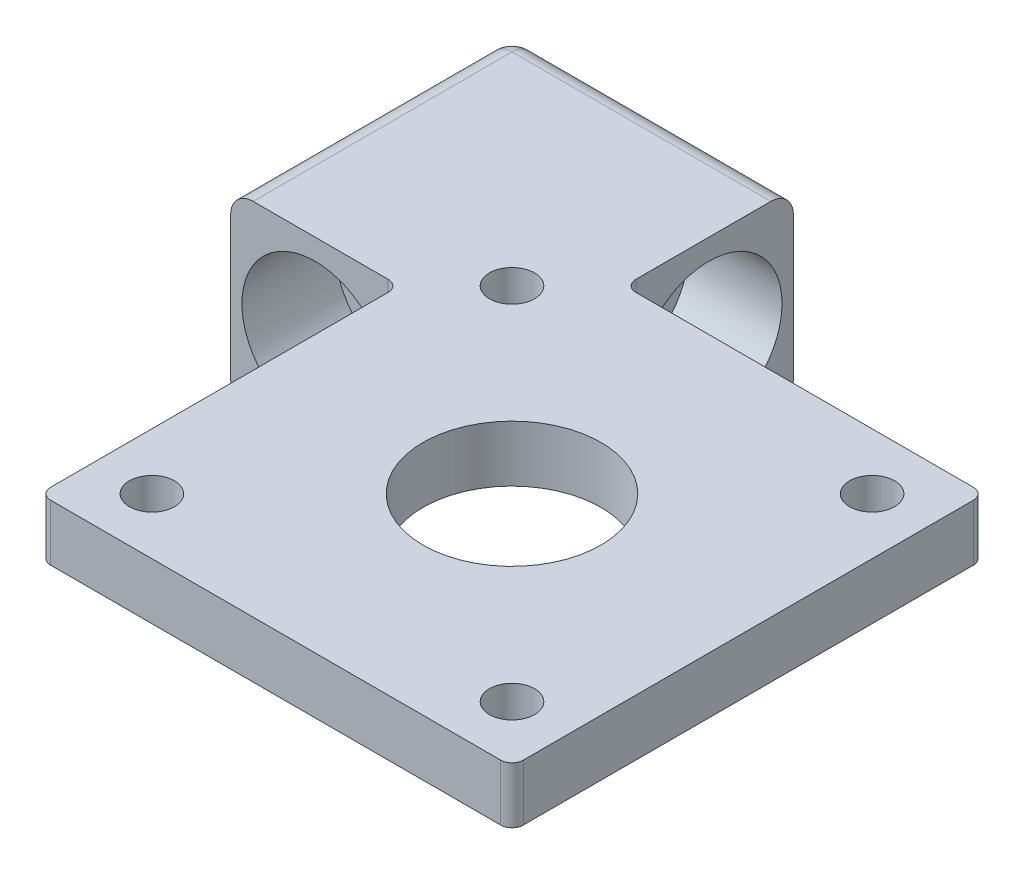
from build123d import *

# Parameters (mm, degrees)
SKETCH1_W           = 15
SKETCH1_H           = 10
SKETCH1_H_2         = 15
SKETCH1_W_2         = 10
BOSS_EXTRUDE1_DEPTH = 16.7
SKETCH2_R           = 6.5
CUT_EXTRUDE1_DEPTH  = 8.3
SKETCH3_R           = 6.5
CUT_EXTRUDE2_DEPTH  = 8.3
SKETCH4_R           = 6.5
CUT_EXTRUDE3_DEPTH  = 14.7
FILLET8_R           = 2
SKETCH5_W           = 42
SKETCH5_H           = 42
SKETCH5_R           = 2
SKETCH5_R_2         = 7.906463766
BOSS_EXTRUDE3_DEPTH = 5
FILLET9_R           = 1


with BuildPart() as part:
    # Sketch1 → Boss-Extrude1 (new body)
    with BuildSketch(Plane(origin=(0, 0, 0), x_dir=(1, 0, 0), z_dir=(0, 1, 0))):
        Rectangle(SKETCH1_W, SKETCH1_H)
        with Locations((0, 12.5)):
            Rectangle(SKETCH1_W, SKETCH1_H_2)
        with Locations((12.5, 12.5)):
            Rectangle(SKETCH1_W_2, SKETCH1_H_2)
    extrude(amount=BOSS_EXTRUDE1_DEPTH)

    # Sketch2 → Cut-Extrude1 (cut)
    with BuildSketch(Plane.XY.offset(5)):
        with Locations((0, 8.35)):
            Circle(SKETCH2_R)
    extrude(amount=-CUT_EXTRUDE1_DEPTH, mode=Mode.SUBTRACT)

    # Sketch3 → Cut-Extrude2 (cut)
    with BuildSketch(Plane(origin=(17.5, 0, 0), x_dir=(0, 0, -1), z_dir=(1, 0, 0))):
        with Locations((12.5, 8.35)):
            Circle(SKETCH3_R)
    extrude(amount=-CUT_EXTRUDE2_DEPTH, mode=Mode.SUBTRACT)

    # Sketch4 → Cut-Extrude3 (cut)
    with BuildSketch(Plane.XZ):
        with Locations(Location((0, -12.5, 0), (0, 0, 270))):
            Circle(SKETCH4_R)
    extrude(amount=-CUT_EXTRUDE3_DEPTH, mode=Mode.SUBTRACT)

    # Fillet8
    # the kernel refuses this fillet: 2 mm, written as the material it adds along each edge
    with BuildSketch(Plane(origin=(7.5, 0, -5), x_dir=(0, 0, 1), z_dir=(0, 1, 0))) as fillet8_piece_1:
        with BuildLine():
            CenterArc((FILLET8_R, FILLET8_R), FILLET8_R, 180, 90)
            Line((0, FILLET8_R), (0, 0))
            Line((0, 0), (FILLET8_R, 0))
        make_face()
    extrude(amount=16.7)
    # the kernel refuses this fillet: 2 mm, written as the material it takes off along each edge
    with BuildSketch(Plane(origin=(-5.5, 2, -18), x_dir=(0, 0, -1), z_dir=(-1, 0, 0))) as fillet8_2_piece_1_section:
        Polygon((0, 0), (FILLET8_R, 0), (FILLET8_R, FILLET8_R), (0, FILLET8_R), align=None)
    fillet8_2_piece_1 = extrude(amount=FILLET8_R, mode=Mode.PRIVATE)
    fillet8_2_piece_1 = fillet8_2_piece_1 - Plane(origin=(-5.5, 2, -18), x_dir=(0, 0.7071067811865475, 0.7071067811865475), z_dir=(-1, 0, 0)) * Sphere(FILLET8_R, mode=Mode.PRIVATE)
    add(fillet8_2_piece_1, mode=Mode.SUBTRACT)
    with BuildSketch(Plane(origin=(-5.5, 14.7, -18), x_dir=(0, 1, 0), z_dir=(-1, 0, 0))) as fillet8_2_piece_2_section:
        Polygon((0, 0), (FILLET8_R, 0), (FILLET8_R, FILLET8_R), (0, FILLET8_R), align=None)
    fillet8_2_piece_2 = extrude(amount=FILLET8_R, mode=Mode.PRIVATE)
    fillet8_2_piece_2 = fillet8_2_piece_2 - Plane(origin=(-5.5, 14.7, -18), x_dir=(0, -0.7071067811865475, 0.7071067811865475), z_dir=(-1, 0, 0)) * Sphere(FILLET8_R, mode=Mode.PRIVATE)
    add(fillet8_2_piece_2, mode=Mode.SUBTRACT)
    with BuildSketch(Plane(origin=(-7.5, 0, -18), x_dir=(0, 1, 0), z_dir=(0, 0, 1)), Plane(origin=(22.5, 16.7, -20), x_dir=(0, 0, 1), z_dir=(-1, 0, 0)), Plane(origin=(-7.5, 16.7, 10), x_dir=(0, -1, 0), z_dir=(0, 0, -1)), Plane(origin=(22.5, 0, -20), x_dir=(0, 1, 0), z_dir=(-1, 0, 0))) as fillet8_2_piece_3:
        with BuildLine():
            CenterArc((FILLET8_R, -FILLET8_R), FILLET8_R, 90, 90)
            Line((0, -FILLET8_R), (0, 0))
            Line((0, 0), (FILLET8_R, 0))
        make_face()
    extrude(amount=28, mode=Mode.SUBTRACT)
    with BuildSketch(Plane(origin=(-7.5, 2, -20), x_dir=(0, 0, 1), z_dir=(0, 1, 0))) as fillet8_2_piece_4:
        with BuildLine():
            CenterArc((FILLET8_R, FILLET8_R), FILLET8_R, 180, 90)
            Line((0, FILLET8_R), (0, 0))
            Line((0, 0), (FILLET8_R, 0))
        make_face()
    extrude(amount=12.7, mode=Mode.SUBTRACT)
    # the kernel refuses this fillet: 2 mm, written as the material it takes off along each edge
    with BuildSketch(Plane(origin=(9.5, 0, -5), x_dir=(0, 0, -1), z_dir=(1, 0, 0))) as fillet8_3_piece_1:
        with BuildLine():
            CenterArc((FILLET8_R, FILLET8_R), FILLET8_R, 180, 90)
            Line((0, FILLET8_R), (0, 0))
            Line((0, 0), (FILLET8_R, 0))
        make_face()
    extrude(amount=13, mode=Mode.SUBTRACT)
    with BuildSketch(Plane(origin=(7.5, 0, -3), x_dir=(-1, 0, 0), z_dir=(0, 0, 1))) as fillet8_3_piece_2:
        with BuildLine():
            CenterArc((FILLET8_R, -FILLET8_R), FILLET8_R, 90, 90)
            Line((0, -FILLET8_R), (0, 0))
            Line((0, 0), (FILLET8_R, 0))
        make_face()
    extrude(amount=13, mode=Mode.SUBTRACT)
    with BuildSketch(Plane(origin=(9.5, 0, -3), x_dir=(-1, 0, 0), z_dir=(0, 0, 1))) as fillet8_3_piece_3:
        with BuildLine():
            CenterArc((2 + FILLET8_R, -FILLET8_R), FILLET8_R, 90, 90)
            Line((2, -FILLET8_R), (2, 0))
            Line((2, 0), (2 + FILLET8_R, 0))
        make_face()
    revolve(axis=Axis((9.5, 0, -3), (0, -1, 0)), revolution_arc=90, mode=Mode.SUBTRACT)

    # Sketch5 → Boss-Extrude3 (add)
    with BuildSketch(Plane(origin=(0, 16.7, 0), x_dir=(1, 0, 0), z_dir=(0, 1, 0))):
        with Locations((28.5, -16)):
            Rectangle(SKETCH5_W, SKETCH5_H)
        with Locations(Location((12.5, 0, 0), (0, 0, 270))):
            Circle(SKETCH5_R, mode=Mode.SUBTRACT)
        with Locations(Location((12.5, -32, 0), (0, 0, 270))):
            Circle(SKETCH5_R, mode=Mode.SUBTRACT)
        with Locations(Location((44.5, -32, 0), (0, 0, 270))):
            Circle(SKETCH5_R, mode=Mode.SUBTRACT)
        with Locations(Location((44.5, 0, 0), (0, 0, 270))):
            Circle(SKETCH5_R, mode=Mode.SUBTRACT)
        with Locations(Location((28.5, -16, 0), (0, 0, 270))):
            Circle(SKETCH5_R_2, mode=Mode.SUBTRACT)
    extrude(amount=-BOSS_EXTRUDE3_DEPTH)

    # Fillet9
    fillet9_edges = [part.edges().sort_by_distance(p)[0] for p in [
        (17.5, 14.2, -5),
        (7.5, 14.2, 5),
        (49.5, 14.2, 37),
        (7.5, 14.2, 37),
        (49.5, 14.2, -5),
    ]]
    fillet(fillet9_edges, radius=FILLET9_R)


solid = part.part
